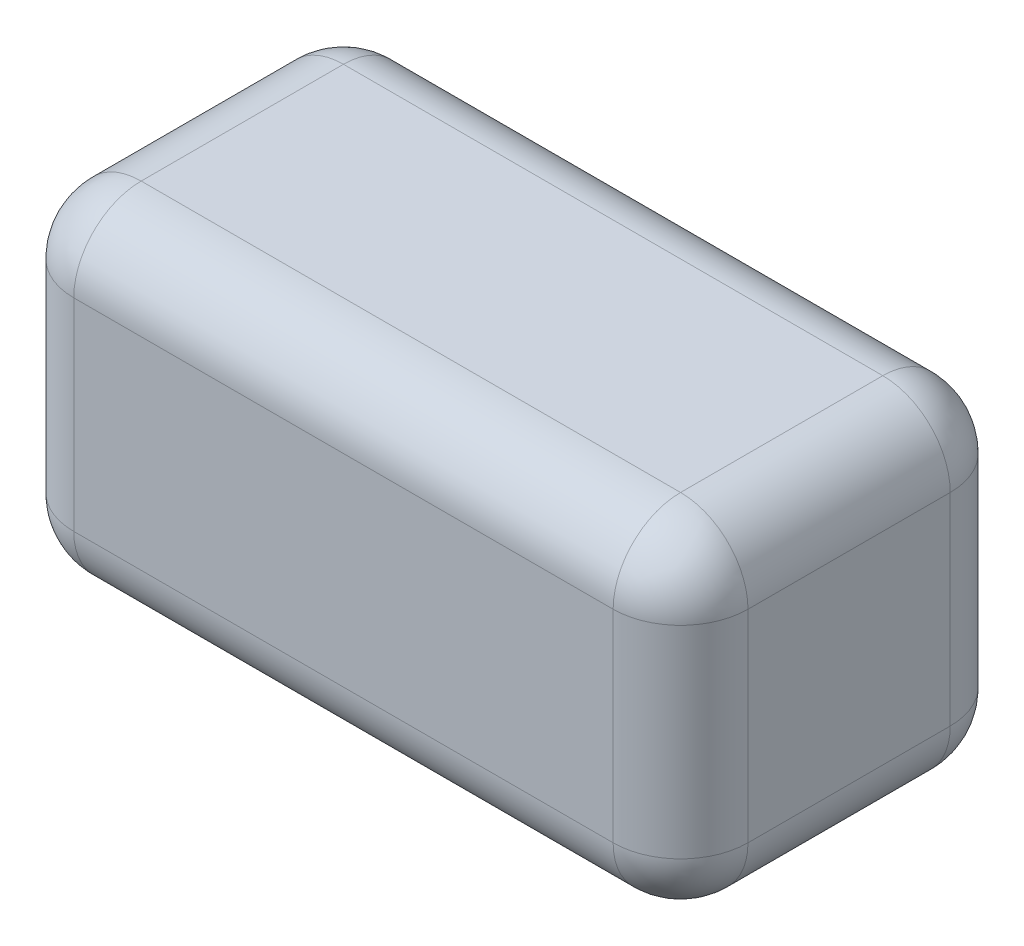
from build123d import *

# Parameters (mm, degrees)
SKETCH1_W           = 100
SKETCH1_H           = 50
BOSS_EXTRUDE1_DEPTH = 50
FILLET1_R           = 10
FILLET2_R           = 10


with BuildPart() as part:
    # Sketch1 → Boss-Extrude1 (new body)
    with BuildSketch(Plane(origin=(0, 0, 0), x_dir=(1, 0, 0), z_dir=(0, 1, 0))):
        Rectangle(SKETCH1_W, SKETCH1_H)
    extrude(amount=BOSS_EXTRUDE1_DEPTH)

    # Fillet1
    fillet1_edges = [part.edges().sort_by_distance(p)[0] for p in [
        (50, 50, 0),
        (0, 50, -25),
        (-50, 50, 0),
        (50, 0, 0),
        (0, 0, 25),
        (50, 25, -25),
        (50, 25, 25),
        (-50, 25, 25),
        (0, 50, 25),
    ]]
    fillet(fillet1_edges, radius=FILLET1_R)

    # Fillet2
    # the kernel refuses this fillet: 10 mm, written as the material it takes off along each edge
    with BuildSketch(Plane(origin=(-40, 10, 15), x_dir=(0, -1, 0), z_dir=(-1, 0, 0))) as fillet2_piece_1_section:
        Polygon((0, 0), (FILLET2_R, 0), (FILLET2_R, FILLET2_R), (0, FILLET2_R), align=None)
    fillet2_piece_1 = extrude(amount=FILLET2_R, mode=Mode.PRIVATE)
    fillet2_piece_1 = fillet2_piece_1 - Plane(origin=(-40, 10, 15), x_dir=(0, 0.7071067811865475, -0.7071067811865475), z_dir=(-1, 0, 0)) * Sphere(FILLET2_R, mode=Mode.PRIVATE)
    add(fillet2_piece_1, mode=Mode.SUBTRACT)
    with BuildSketch(Plane(origin=(-40, 40, -15), x_dir=(-1, 0, 0), z_dir=(0, 0, -1))) as fillet2_piece_2_section:
        Polygon((0, 0), (FILLET2_R, 0), (FILLET2_R, FILLET2_R), (0, FILLET2_R), align=None)
    fillet2_piece_2 = extrude(amount=FILLET2_R, mode=Mode.PRIVATE)
    fillet2_piece_2 = fillet2_piece_2 - Plane(origin=(-40, 40, -15), x_dir=(0.7071067811865475, -0.7071067811865475, 0), z_dir=(0, 0, -1)) * Sphere(FILLET2_R, mode=Mode.PRIVATE)
    add(fillet2_piece_2, mode=Mode.SUBTRACT)
    with BuildSketch(Plane(origin=(40, 10, -15), x_dir=(0, -1, 0), z_dir=(0, 0, -1))) as fillet2_piece_3_section:
        Polygon((0, 0), (FILLET2_R, 0), (FILLET2_R, -FILLET2_R), (0, -FILLET2_R), align=None)
    fillet2_piece_3 = extrude(amount=FILLET2_R, mode=Mode.PRIVATE)
    fillet2_piece_3 = fillet2_piece_3 - Plane(origin=(40, 10, -15), x_dir=(-0.7071067811865475, 0.7071067811865475, 0), z_dir=(0, 0, -1)) * Sphere(FILLET2_R, mode=Mode.PRIVATE)
    add(fillet2_piece_3, mode=Mode.SUBTRACT)
    with BuildSketch(Plane(origin=(-40, 10, -15), x_dir=(-1, 0, 0), z_dir=(0, 0, -1))) as fillet2_piece_4_section:
        Polygon((0, 0), (FILLET2_R, 0), (FILLET2_R, -FILLET2_R), (0, -FILLET2_R), align=None)
    fillet2_piece_4 = extrude(amount=FILLET2_R, mode=Mode.PRIVATE)
    fillet2_piece_4 = fillet2_piece_4 - Plane(origin=(-40, 10, -15), x_dir=(0.7071067811865475, 0.7071067811865475, 0), z_dir=(0, 0, -1)) * Sphere(FILLET2_R, mode=Mode.PRIVATE)
    add(fillet2_piece_4, mode=Mode.SUBTRACT)
    with BuildSketch(Plane(origin=(40, 0, -25), x_dir=(0, 1, 0), z_dir=(-1, 0, 0))) as fillet2_piece_5:
        with BuildLine():
            CenterArc((FILLET2_R, -FILLET2_R), FILLET2_R, 90, 90)
            Line((0, -FILLET2_R), (0, 0))
            Line((0, 0), (FILLET2_R, 0))
        make_face()
    extrude(amount=80, mode=Mode.SUBTRACT)
    with BuildSketch(Plane(origin=(-50, 10, -25), x_dir=(1, 0, 0), z_dir=(0, 1, 0)), Plane(origin=(-50, 0, -15), x_dir=(0, 1, 0), z_dir=(0, 0, 1))) as fillet2_piece_6:
        with BuildLine():
            CenterArc((FILLET2_R, -FILLET2_R), FILLET2_R, 90, 90)
            Line((0, -FILLET2_R), (0, 0))
            Line((0, 0), (FILLET2_R, 0))
        make_face()
    extrude(amount=30, mode=Mode.SUBTRACT)


solid = part.part
